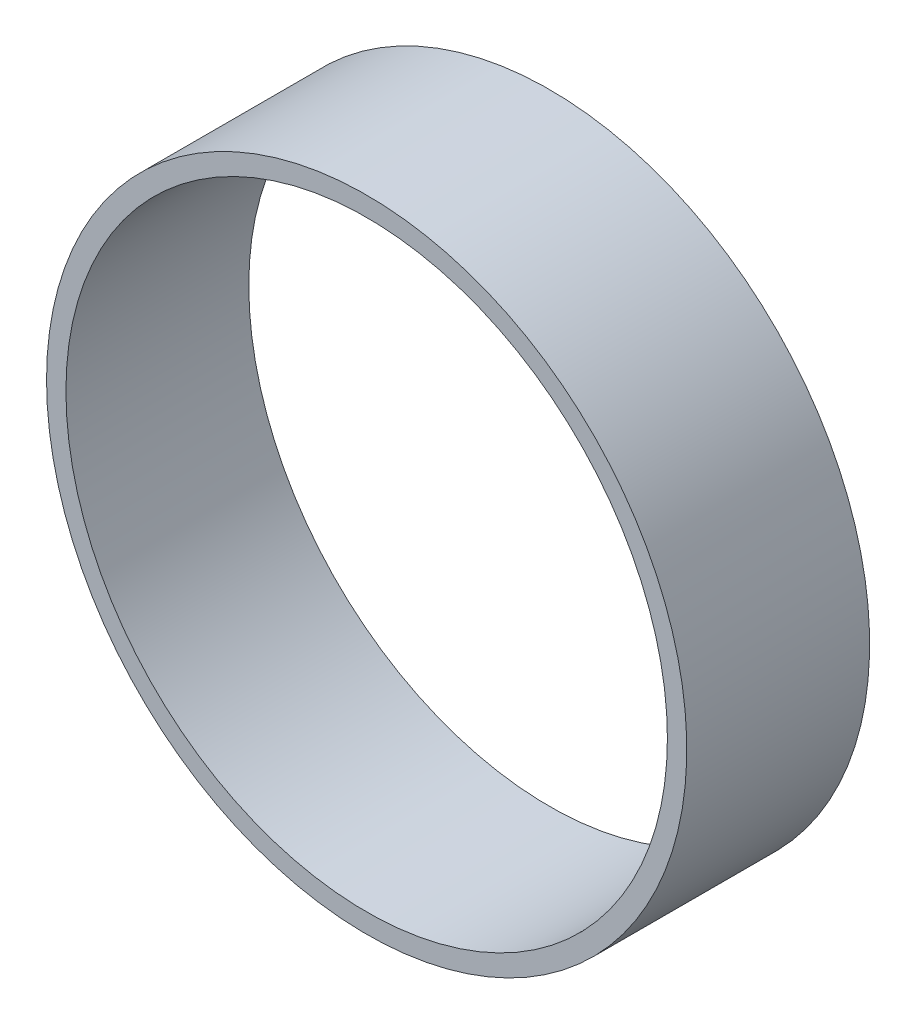
from build123d import *

# Parameters (mm, degrees)
SKETCH1_W         = 47.15
SKETCH1_H         = 5
CIRPATTERN1_COUNT = 20


with BuildPart() as part:
    # Sketch1 → Revolve1 (revolve)
    with BuildSketch(Plane(origin=(0, 0, 0), x_dir=(0, 0, -1), z_dir=(1, 0, 0))):
        with Locations((24.575, 80.05)):
            Rectangle(SKETCH1_W, SKETCH1_H)
    revolve(axis=Axis((0, 0, -50.5075), (0, 0, 1)))

    # CirPattern1: part ×20 about axis
    cirpattern1_axis = Axis((0, 0, -50.5075), (0, 0, 1))


with BuildPart() as part_1:
    add(part.part)
    for i in range(1, CIRPATTERN1_COUNT):
        add(part.part.rotate(cirpattern1_axis, i * 360 / CIRPATTERN1_COUNT))


solid = part_1.part
